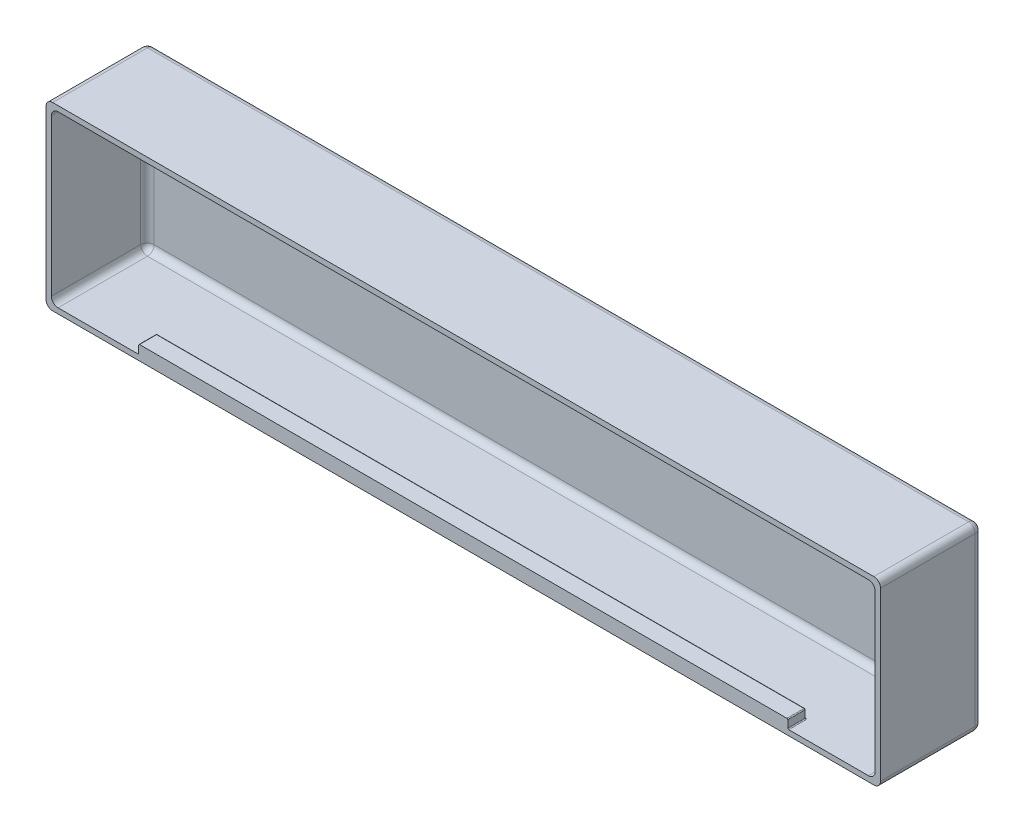
from build123d import *

# Parameters (mm, degrees)
SKETCH1_W           = 237.236
SKETCH1_H           = 51.308
BOSS_EXTRUDE1_DEPTH = 28.829
SHELL1_T            = -1.524
FILLET1_R           = 1.905
FILLET2_R           = 1.905
SKETCH2_R           = 4.826
CUT_EXTRUDE1_DEPTH  = 2.54
SKETCH3_W           = 184.531
SKETCH3_H           = 5.08
BOSS_EXTRUDE2_DEPTH = 2.54
FILLET3_R           = 0.254


with BuildPart() as part:
    # Sketch1 → Boss-Extrude1 (new body)
    with BuildSketch(Plane.XY):
        Rectangle(SKETCH1_W, SKETCH1_H)
    extrude(amount=BOSS_EXTRUDE1_DEPTH)

    # Shell1
    shell1_openings = [part.faces().sort_by_distance(p)[0] for p in [
        (0, 0, 28.829),
    ]]
    offset(amount=SHELL1_T, openings=shell1_openings, kind=Kind.INTERSECTION)

    # Fillet1
    fillet1_edges = [part.edges().sort_by_distance(p)[0] for p in [
        (0, -24.13, 1.524),
        (-117.094, 0, 1.524),
        (0, 24.13, 1.524),
        (117.094, 0, 1.524),
        (117.094, -24.13, 15.1765),
        (117.094, 24.13, 15.1765),
        (-117.094, -24.13, 15.1765),
        (-117.094, 24.13, 15.1765),
    ]]
    fillet(fillet1_edges, radius=FILLET1_R)

    # Fillet2
    fillet2_edges = [part.edges().sort_by_distance(p)[0] for p in [
        (118.618, 0, 0),
        (-118.618, 0, 0),
        (0, 25.654, 0),
        (-118.618, 25.654, 14.4145),
        (-118.618, -25.654, 14.4145),
        (0, -25.654, 0),
        (118.618, -25.654, 14.4145),
        (118.618, 25.654, 14.4145),
    ]]
    fillet(fillet2_edges, radius=FILLET2_R)

    # Sketch2 → Cut-Extrude1 (cut)
    with BuildSketch(Plane(origin=(0, 0, 0), x_dir=(-1, 0, 0), z_dir=(0, 0, -1))):
        with Locations((-45.2, 1.571)):
            Circle(SKETCH2_R)
        with Locations((45, 1.571)):
            Circle(SKETCH2_R)
    extrude(amount=-CUT_EXTRUDE1_DEPTH, mode=Mode.SUBTRACT)

    # Sketch3 → Boss-Extrude2 (add)
    with BuildSketch(Plane(origin=(0, -24.13, 0), x_dir=(1, 0, 0), z_dir=(0, 1, 0))):
        with Locations((0, -26.289)):
            Rectangle(SKETCH3_W, SKETCH3_H)
    extrude(amount=BOSS_EXTRUDE2_DEPTH)

    # Fillet3
    fillet3_edges = [part.edges().sort_by_distance(p)[0] for p in [
        (-92.2655, -22.86, 23.749),
        (-92.2655, -21.59, 26.289),
        (0, -21.59, 23.749),
        (92.2655, -21.59, 26.289),
        (92.2655, -24.13, 26.289),
        (-92.2655, -24.13, 26.289),
        (0, -24.13, 23.749),
        (92.2655, -22.86, 23.749),
    ]]
    fillet(fillet3_edges, radius=FILLET3_R)


solid = part.part
